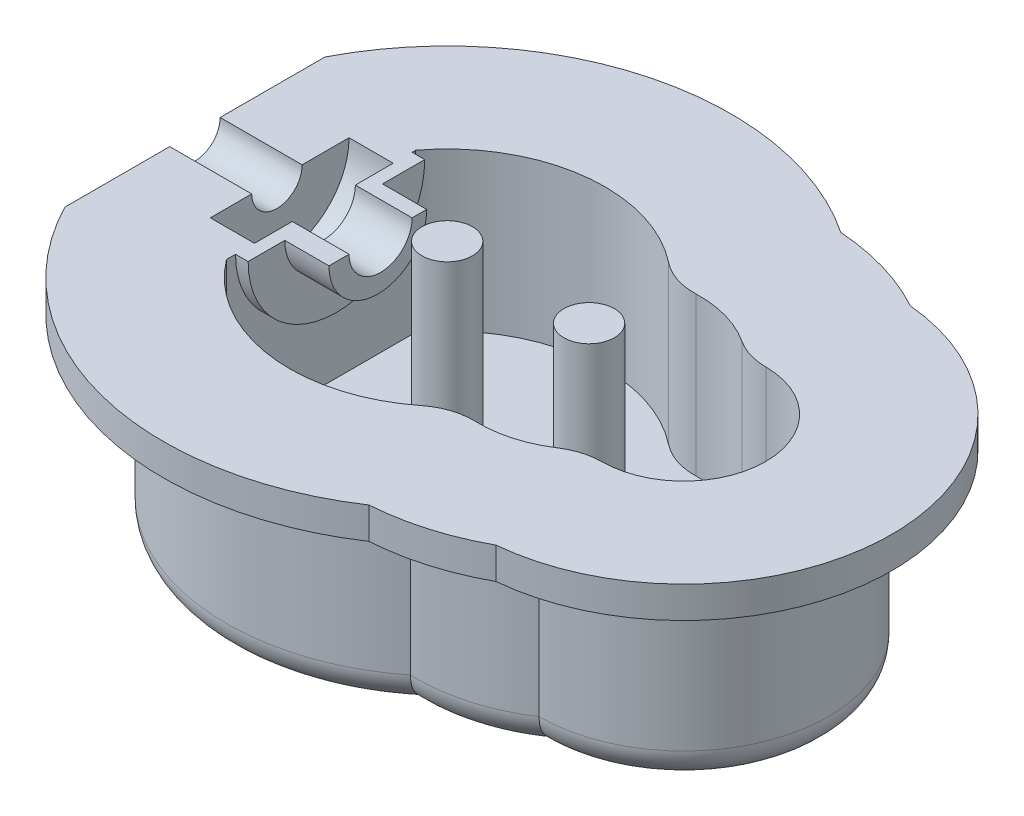
from build123d import *

# Parameters (mm, degrees)
SKETCH1_R             = 4
SKETCH1_R_2           = 11
BOSS_EXTRUDE1_DEPTH   = 10
BOSS_EXTRUDE2_DEPTH   = 30
BOSS_EXTRUDE3_DEPTH   = 5
SKETCH6_R             = 11
CUT_EXTRUDE2_DEPTH    = 7
CUT_EXTRUDE3_REACH    = 126.339
SKETCH3_R             = 4
FILLET1_R             = 5
BOSS_EXTRUDE4_START   = 10
SKETCH1_4_R           = 4
BOSS_EXTRUDE4_DEPTH   = 30
BOSS_EXTRUDE4_2_DEPTH = 30
CUT_EXTRUDE5_START    = 3
SKETCH7_R             = 11
CUT_EXTRUDE5_DEPTH    = 7
SKETCH8_R             = 4
CUT_EXTRUDE6_DEPTH    = 96.5
BOSS_EXTRUDE8_START   = 9
BOSS_EXTRUDE8_DEPTH   = 9
CUT_EXTRUDE7_DEPTH    = 7


with BuildPart() as part:
    # Sketch1 → Boss-Extrude1 (new body)
    # profile 1 of 4: a face of its own
    with BuildSketch(Plane(origin=(0, 0, 0), x_dir=(1, 0, 0), z_dir=(0, 1, 0))):
        with BuildLine():
            ThreePointArc((-15.53030303, -17.49196326), (-18.965809959, -17.990656132), (-22.023809524, -19.633836312))
            ThreePointArc((-22.023809524, -19.633836312), (-40.737950416, -24.78942672), (-57.5, -15))
            Line((-57.5, -15), (-57.5, 15))
            ThreePointArc((-57.5, 15), (-40.737950416, 24.78942672), (-22.023809524, 19.633836312))
            ThreePointArc((-22.023809524, 19.633836312), (-18.965809959, 17.990656132), (-15.53030303, 17.49196326))
            ThreePointArc((-15.53030303, 17.49196326), (-10.248929974, 16.842723462), (-5.406818182, 14.63628582))
            ThreePointArc((-5.406818182, 14.63628582), (-2.801045952, 13.422385369), (0.042391304, 12.999930884))
            ThreePointArc((0.042391304, 12.999930884), (13, 0), (0.042391304, -12.999930884))
            ThreePointArc((0.042391304, -12.999930884), (-2.801045952, -13.422385369), (-5.406818182, -14.63628582))
            ThreePointArc((-5.406818182, -14.63628582), (-10.248929974, -16.842723462), (-15.53030303, -17.49196326))
        make_face()
        with Locations((-37.5, 0)):
            Circle(SKETCH1_R, mode=Mode.SUBTRACT)
        Circle(SKETCH1_R_2, mode=Mode.SUBTRACT)
        with Locations((-15, 0)):
            Circle(SKETCH1_R, mode=Mode.SUBTRACT)
    # profile 2 of 4: a face of its own
    with BuildSketch(Plane(origin=(0, 0, 0), x_dir=(1, 0, 0), z_dir=(0, 1, 0))):
        with Locations((-37.5, 0)):
            Circle(SKETCH1_R)
    # profile 3 of 4: a face of its own
    with BuildSketch(Plane(origin=(0, 0, 0), x_dir=(1, 0, 0), z_dir=(0, 1, 0))):
        with Locations((-15, 0)):
            Circle(SKETCH1_R)
    # profile 4 of 4: a face of its own
    with BuildSketch(Plane(origin=(0, 0, 0), x_dir=(1, 0, 0), z_dir=(0, 1, 0))):
        Circle(SKETCH1_R_2)
    extrude(amount=BOSS_EXTRUDE1_DEPTH)

    # Sketch1<3> → Boss-Extrude2 (add)
    with BuildSketch(Plane(origin=(0, 0, 0), x_dir=(1, 0, 0), z_dir=(0, 1, 0))):
        with BuildLine():
            Line((-67.5, -18.027756377), (-67.5, 18.027756377))
            ThreePointArc((-67.5, 18.027756377), (-43.803347329, 34.427718665), (-15.833333333, 27.487370837))
            ThreePointArc((-15.833333333, 27.487370837), (-7.534032816, 26.467136868), (0.075, 22.999877717))
            ThreePointArc((0.075, 22.999877717), (23, 0), (0.075, -22.999877717))
            ThreePointArc((0.075, -22.999877717), (-7.534032816, -26.467136868), (-15.833333333, -27.487370837))
            ThreePointArc((-15.833333333, -27.487370837), (-43.803347329, -34.427718665), (-67.5, -18.027756377))
        make_face()
        with BuildLine():
            Line((-57.5, -15), (-57.5, 15))
            ThreePointArc((-57.5, 15), (-40.737950416, 24.78942672), (-22.023809524, 19.633836312))
            ThreePointArc((-22.023809524, 19.633836312), (-18.965809959, 17.990656132), (-15.53030303, 17.49196326))
            ThreePointArc((-15.53030303, 17.49196326), (-10.248929974, 16.842723462), (-5.406818182, 14.63628582))
            ThreePointArc((-5.406818182, 14.63628582), (-2.801045952, 13.422385369), (0.042391304, 12.999930884))
            ThreePointArc((0.042391304, 12.999930884), (13, 0), (0.042391304, -12.999930884))
            ThreePointArc((0.042391304, -12.999930884), (-2.801045952, -13.422385369), (-5.406818182, -14.63628582))
            ThreePointArc((-5.406818182, -14.63628582), (-10.248929974, -16.842723462), (-15.53030303, -17.49196326))
            ThreePointArc((-15.53030303, -17.49196326), (-18.965809959, -17.990656132), (-22.023809524, -19.633836312))
            ThreePointArc((-22.023809524, -19.633836312), (-40.737950416, -24.78942672), (-57.5, -15))
        make_face(mode=Mode.SUBTRACT)
    extrude(amount=BOSS_EXTRUDE2_DEPTH)

    # Sketch2 → Boss-Extrude3 (add)
    with BuildSketch(Plane(origin=(0, 30, 0), x_dir=(1, 0, 0), z_dir=(0, 1, 0))):
        with BuildLine():
            Line((-77.5, -20.615528128), (-77.5, 20.615528128))
            ThreePointArc((-77.5, 20.615528128), (-48.761384661, 43.568121551), (-12.5, 37.416573868))
            ThreePointArc((-12.5, 37.416573868), (-4.462855904, 35.989145507), (3.075, 32.856420605))
            ThreePointArc((3.075, 32.856420605), (33, 0), (3.075, -32.856420605))
            ThreePointArc((3.075, -32.856420605), (-4.462855904, -35.989145507), (-12.5, -37.416573868))
            ThreePointArc((-12.5, -37.416573868), (-48.761384661, -43.568121551), (-77.5, -20.615528128))
        make_face()
        with BuildLine():
            Line((-57.5, -15), (-57.5, 15))
            ThreePointArc((-57.5, 15), (-40.737950416, 24.78942672), (-22.023809524, 19.633836312))
            ThreePointArc((-22.023809524, 19.633836312), (-18.965809959, 17.990656132), (-15.53030303, 17.49196326))
            ThreePointArc((-15.53030303, 17.49196326), (-10.248929974, 16.842723462), (-5.406818182, 14.63628582))
            ThreePointArc((-5.406818182, 14.63628582), (-2.801045952, 13.422385369), (0.042391304, 12.999930884))
            ThreePointArc((0.042391304, 12.999930884), (13, 0), (0.042391304, -12.999930884))
            ThreePointArc((0.042391304, -12.999930884), (-2.801045952, -13.422385369), (-5.406818182, -14.63628582))
            ThreePointArc((-5.406818182, -14.63628582), (-10.248929974, -16.842723462), (-15.53030303, -17.49196326))
            ThreePointArc((-15.53030303, -17.49196326), (-18.965809959, -17.990656132), (-22.023809524, -19.633836312))
            ThreePointArc((-22.023809524, -19.633836312), (-40.737950416, -24.78942672), (-57.5, -15))
        make_face(mode=Mode.SUBTRACT)
    extrude(amount=BOSS_EXTRUDE3_DEPTH)

    # Sketch6 → Cut-Extrude2 (cut)
    with BuildSketch(Plane(origin=(-57.5, 0, 0), x_dir=(0, 0, -1), z_dir=(1, 0, 0))):
        with Locations((0.437281594, 35)):
            Circle(SKETCH6_R)
    extrude(amount=-CUT_EXTRUDE2_DEPTH, mode=Mode.SUBTRACT)

    # Sketch3 → Cut-Extrude3 (cut, up to next)
    with BuildSketch(Plane.ZY.offset(77.5), mode=Mode.PRIVATE) as cut_extrude3_sk1:
        with Locations((0, 35)):
            Circle(SKETCH3_R)
    cut_extrude3_tool1 = extrude(cut_extrude3_sk1.sketch, amount=-CUT_EXTRUDE3_REACH, mode=Mode.PRIVATE) & part.part
    add(cut_extrude3_tool1.solids().sort_by_distance((-77.5, 35, 0))[0], mode=Mode.SUBTRACT)

    # Fillet1
    fillet1_edges = [part.edges().sort_by_distance(p)[0] for p in [
        (-43.803347329, 0, 34.427718665),
        (-7.534032816, 0, 26.467136868),
        (23, 0, 0),
        (-7.534032816, 0, -26.467136868),
        (-43.803347329, 0, -34.427718665),
        (-67.5, 0, 0),
    ]]
    fillet(fillet1_edges, radius=FILLET1_R - 0.0001)  # a hair under: the kernel refuses the full size

    # Sketch7 → Cut-Extrude5 (cut)
    with BuildSketch(Plane.XZ.offset(-10).offset(CUT_EXTRUDE5_START)):
        with Locations(Location((0, 0, 0), (0, 0, 90))):
            Circle(SKETCH7_R)
    extrude(amount=CUT_EXTRUDE5_DEPTH, mode=Mode.SUBTRACT)

    # Sketch8 → Cut-Extrude6 (cut, through all)
    with BuildSketch(Plane.XZ.offset(-7)):
        with Locations(Location((0, 0, 0), (0, 0, 270))):
            Circle(SKETCH8_R)
    extrude(amount=-CUT_EXTRUDE6_DEPTH, mode=Mode.SUBTRACT)

    # Sketch9 → Boss-Extrude8 (add)
    with BuildSketch(Plane(origin=(-57.5, 0, 0), x_dir=(0, 0, -1), z_dir=(1, 0, 0)).offset(BOSS_EXTRUDE8_START)):
        with BuildLine():
            ThreePointArc((-4.562718406, 35), (0.437281594, 30), (5.437281594, 35))
            Line((5.437281594, 35), (11.437281594, 35))
            ThreePointArc((11.437281594, 35), (0.437281594, 24), (-10.562718406, 35))
            Line((-10.562718406, 35), (-4.562718406, 35))
        make_face()
        with BuildLine():
            Line((-10.562718406, 35), (-13.562718406, 35))
            ThreePointArc((-13.562718406, 35), (0.437281594, 21), (14.437281594, 35))
            Line((14.437281594, 35), (11.437281594, 35))
            ThreePointArc((11.437281594, 35), (0.437281594, 24), (-10.562718406, 35))
        make_face()
    extrude(amount=-BOSS_EXTRUDE8_DEPTH)

    # Sketch11 → Cut-Extrude7 (cut)
    with BuildSketch(Plane(origin=(-48.5, 0, 0), x_dir=(0, 0, -1), z_dir=(1, 0, 0))):
        with BuildLine():
            Line((-13.562718406, 35), (-7.75, 35))
            ThreePointArc((-7.75, 35), (0, 27.25), (7.75, 35))
            Line((7.75, 35), (14.437281594, 35))
            ThreePointArc((14.437281594, 35), (0.437281594, 21), (-13.562718406, 35))
        make_face()
    extrude(amount=-CUT_EXTRUDE7_DEPTH, mode=Mode.SUBTRACT)


with BuildPart() as body_2:
    # Sketch1<4> → Boss-Extrude4 (new body)
    with BuildSketch(Plane(origin=(0, 0, 0), x_dir=(1, 0, 0), z_dir=(0, 1, 0)).offset(BOSS_EXTRUDE4_START)):
        with Locations(Location((-37.5, 0, 0), (0, 0, 270))):
            Circle(SKETCH1_4_R)
    extrude(amount=BOSS_EXTRUDE4_DEPTH)


with BuildPart() as body_3:
    # Sketch1<4> → Boss-Extrude4 2 (new body)
    with BuildSketch(Plane(origin=(0, 0, 0), x_dir=(1, 0, 0), z_dir=(0, 1, 0)).offset(BOSS_EXTRUDE4_START)):
        with Locations(Location((-15, 0, 0), (0, 0, 270))):
            Circle(SKETCH1_4_R)
    extrude(amount=BOSS_EXTRUDE4_2_DEPTH)


solid = Compound([part.part, body_2.part, body_3.part])
